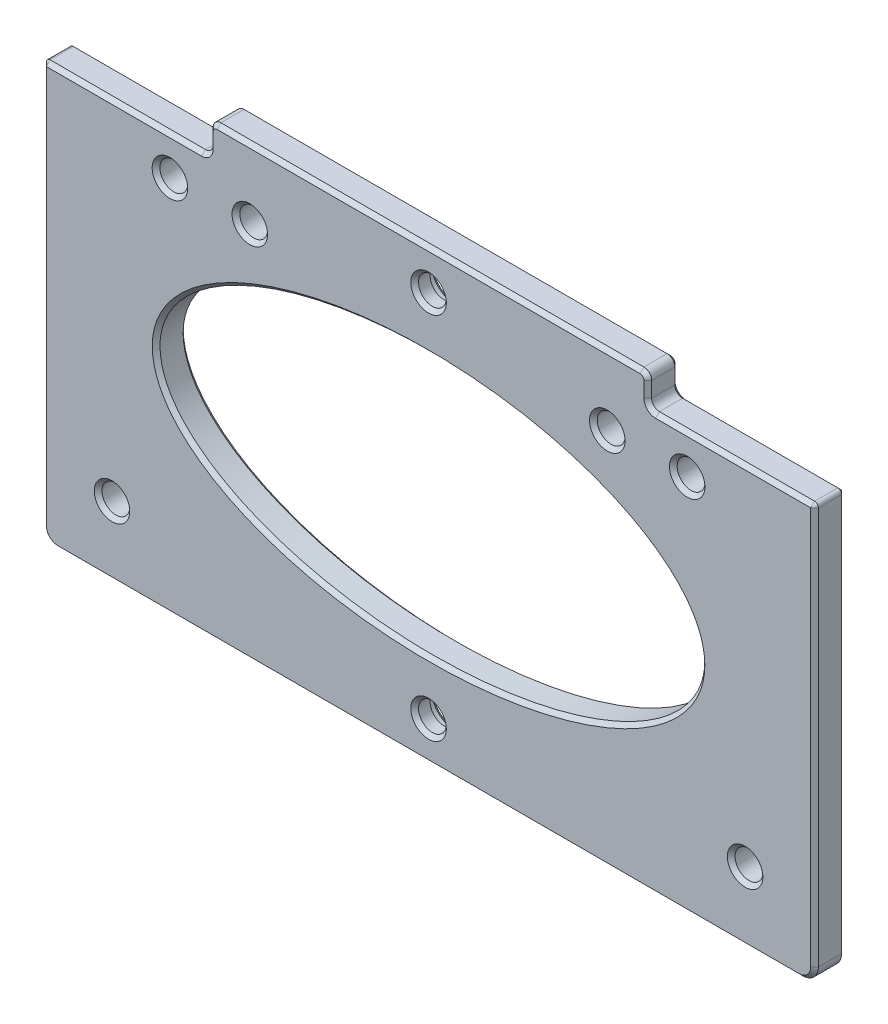
from build123d import *

# Parameters (mm, degrees)
AUFSATZ_LINEAR_AUSTRAGEN1_DEPTH = 4
SKIZZE2_R                       = 1.8
SCHNITT_LINEAR_AUSTRAGEN1_DEPTH = 10
SKIZZE3_R                       = 3.15
SCHNITT_LINEAR_AUSTRAGEN2_DEPTH = 2
SKIZZE4_R                       = 1.8
SCHNITT_LINEAR_AUSTRAGEN3_DEPTH = 10
SKIZZE5_RX                      = 35.285251933
SKIZZE5_RY                      = 16.965913404
SCHNITT_LINEAR_AUSTRAGEN4_DEPTH = 10
VERRUNDUNG1_R                   = 1
VERRUNDUNG2_R                   = 0.5
VERRUNDUNG3_R                   = 2
FASE1_SIZE                      = 0.5


with BuildPart() as part:
    # Skizze1 → Aufsatz-Linear austragen1 (new body)
    with BuildSketch(Plane.XY):
        Polygon((50, -29), (-50, -29), (-50, 25), (-28.4, 25), (-28.4, 29), (28.4, 29), (28.4, 25), (50, 25), align=None)
    extrude(amount=AUFSATZ_LINEAR_AUSTRAGEN1_DEPTH)

    # Skizze2 → Schnitt-Linear austragen1 (cut)
    with BuildSketch(Plane.XY.offset(4)):
        with Locations((0, 23.897853003)):
            Circle(SKIZZE2_R)
        with Locations((0, -23.897853003)):
            Circle(SKIZZE2_R)
    extrude(amount=-SCHNITT_LINEAR_AUSTRAGEN1_DEPTH, mode=Mode.SUBTRACT)

    # Skizze3 → Schnitt-Linear austragen2 (cut)
    with BuildSketch(Plane(origin=(0, 0, 0), x_dir=(-1, 0, 0), z_dir=(0, 0, -1))):
        with Locations((0, -23.897853003)):
            Circle(SKIZZE3_R)
        with Locations((0, 23.897853003)):
            Circle(SKIZZE3_R)
    extrude(amount=-SCHNITT_LINEAR_AUSTRAGEN2_DEPTH, mode=Mode.SUBTRACT)

    # Skizze4 → Schnitt-Linear austragen3 (cut)
    with BuildSketch(Plane.XY.offset(4)):
        with Locations((-33.5, 20)):
            Circle(SKIZZE4_R)
        with Locations((33.5, 20)):
            Circle(SKIZZE4_R)
        with Locations((-41, -20)):
            Circle(SKIZZE4_R)
        with Locations((41, -20)):
            Circle(SKIZZE4_R)
        with Locations((-23.15, 20)):
            Circle(SKIZZE4_R)
        with Locations((23.15, 20)):
            Circle(SKIZZE4_R)
    extrude(amount=-SCHNITT_LINEAR_AUSTRAGEN3_DEPTH, mode=Mode.SUBTRACT)

    # Skizze5 → Schnitt-Linear austragen4 (cut)
    with BuildSketch(Plane(origin=(0, 0, 0), x_dir=(-1, 0, 0), z_dir=(0, 0, -1))):
        with Locations(Location((0, 0), (0, 0, 0))):
            Ellipse(SKIZZE5_RX, SKIZZE5_RY)
    extrude(amount=-SCHNITT_LINEAR_AUSTRAGEN4_DEPTH, mode=Mode.SUBTRACT)

    # Verrundung1
    verrundung1_edges = [part.edges().sort_by_distance(p)[0] for p in [
        (-28.4, 25, 2),
        (-28.4, 29, 2),
        (28.4, 29, 2),
        (28.4, 25, 2),
    ]]
    fillet(verrundung1_edges, radius=VERRUNDUNG1_R)

    # Verrundung2
    verrundung2_edges = [part.edges().sort_by_distance(p)[0] for p in [
        (-50, 25, 2),
        (50, 25, 2),
    ]]
    fillet(verrundung2_edges, radius=VERRUNDUNG2_R)

    # Verrundung3
    verrundung3_edges = [part.edges().sort_by_distance(p)[0] for p in [
        (50, -29, 2),
        (-50, -29, 2),
    ]]
    fillet(verrundung3_edges, radius=VERRUNDUNG3_R)

    # Fase1
    fase1_edges = [part.edges().sort_by_distance(p)[0] for p in [
        (-50, -1.25, 0),
        (-50, -1.25, 4),
        (39.45, 25, 0),
        (49.853553391, 24.853553391, 0),
        (-49.853553391, 24.853553391, 0),
        (39.45, 25, 4),
        (49.853553391, 24.853553391, 4),
        (-49.853553391, 24.853553391, 4),
        (0, -29, 0),
        (0, -29, 4),
        (50, -1.25, 0),
        (49.414213562, -28.414213562, 0),
        (-49.414213562, -28.414213562, 0),
        (50, -1.25, 4),
        (49.414213562, -28.414213562, 4),
        (-49.414213562, -28.414213562, 4),
        (-1.8, 23.897853003, 4),
        (-1.8, -23.897853003, 4),
        (3.15, -23.897853003, 0),
        (3.15, 23.897853003, 0),
        (-24.95, 20, 0),
        (-24.95, 20, 4),
        (39.2, -20, 0),
        (39.2, -20, 4),
        (-42.8, -20, 0),
        (-42.8, -20, 4),
        (31.7, 20, 0),
        (31.7, 20, 4),
        (21.35, 20, 0),
        (21.35, 20, 4),
        (-35.3, 20, 0),
        (-35.3, 20, 4),
        (35.285251708, -0.002237355, 4),
        (35.285251933, 0, 0),
        (-39.45, 25, 0),
        (-39.45, 25, 4),
        (-28.4, 27, 0),
        (-28.4, 27, 4),
        (0, 29, 0),
        (28.4, 27, 0),
        (28.107106781, 28.707106781, 0),
        (-28.107106781, 28.707106781, 0),
        (0, 29, 4),
        (28.4, 27, 4),
        (28.107106781, 28.707106781, 4),
        (-28.107106781, 28.707106781, 4),
        (-28.692893219, 25.292893219, 0),
        (-28.692893219, 25.292893219, 4),
        (28.692893219, 25.292893219, 0),
        (28.692893219, 25.292893219, 4),
    ]]
    chamfer(fase1_edges, length=FASE1_SIZE - 0.0001)  # a hair under: the kernel refuses the full size


solid = part.part
